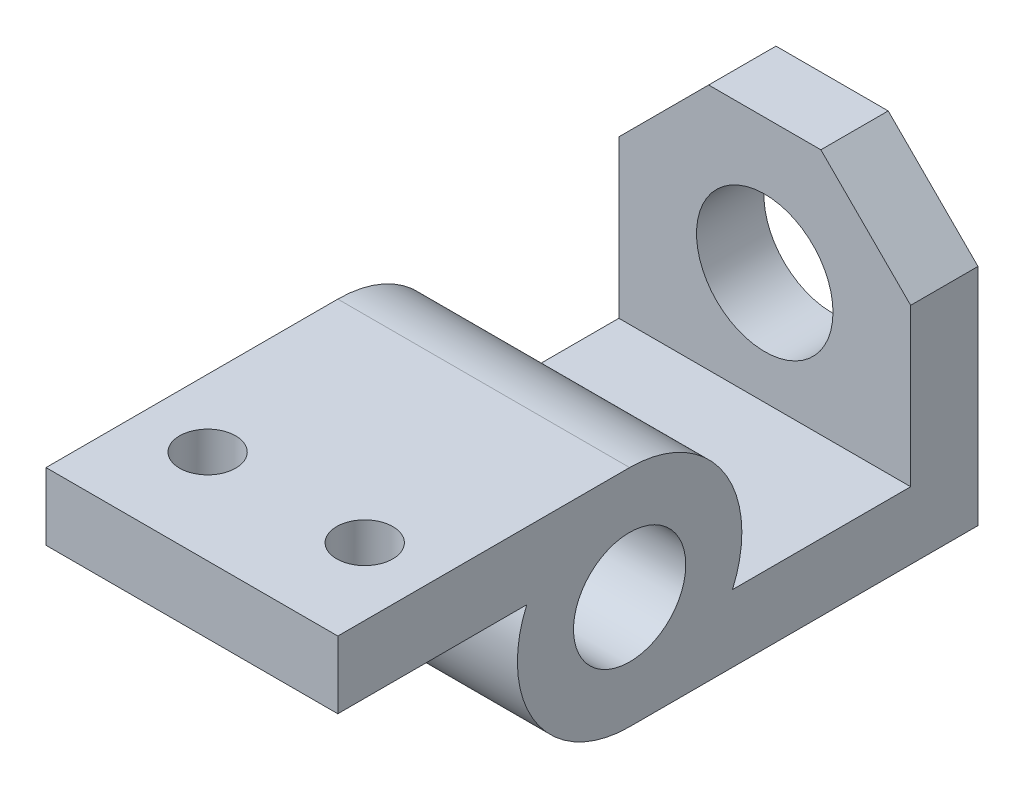
from build123d import *

# Parameters (mm, degrees)
SKETCH2_R           = 15.875
BOSS_EXTRUDE1_DEPTH = 82.55
SKETCH4_R           = 7.9375
CUT_EXTRUDE1_DEPTH  = 144.384968543
SKETCH5_R           = 19.304
CUT_EXTRUDE2_DEPTH  = 191.634403254


with BuildPart() as part:
    # Sketch2 → Boss-Extrude1 (new body)
    with BuildSketch(Plane(origin=(0, 0, 0), x_dir=(0, 0, -1), z_dir=(1, 0, 0))):
        with BuildLine():
            ThreePointArc((29.099355663, -12.7), (26.563955842, 17.390191201), (0, 31.75))
            Line((0, 31.75), (-82.55, 31.75))
            Line((-82.55, 31.75), (-82.55, 12.7))
            Line((-82.55, 12.7), (-29.099355663, 12.7))
            ThreePointArc((-29.099355663, 12.7), (-26.563955842, -17.390191201), (0, -31.75))
            Line((0, -31.75), (98.552, -31.75))
            Line((98.552, -31.75), (98.552, 57.15))
            Line((98.552, 57.15), (79.502, 57.15))
            Line((79.502, 57.15), (79.502, -12.7))
            Line((79.502, -12.7), (29.099355663, -12.7))
        make_face()
        Circle(SKETCH2_R, mode=Mode.SUBTRACT)
    extrude(amount=-BOSS_EXTRUDE1_DEPTH)

    # Sketch4 → Cut-Extrude1 (cut, through all)
    with BuildSketch(Plane(origin=(0, 31.75, 0), x_dir=(1, 0, 0), z_dir=(0, 1, 0))):
        with Locations((-63.5, -55.88)):
            Circle(SKETCH4_R)
        with Locations((-19.05, -55.88)):
            Circle(SKETCH4_R)
    extrude(amount=-CUT_EXTRUDE1_DEPTH, mode=Mode.SUBTRACT)

    # Sketch5 → Cut-Extrude2 (cut, through all)
    with BuildSketch(Plane.XY.offset(-79.502)):
        Polygon((-25.4, 57.15), (0, 31.75), (0, 57.15), align=None)
        Polygon((-82.55, 31.75), (-57.15, 57.15), (-82.55, 57.15), align=None)
        with Locations((-41.275, 19.05)):
            Circle(SKETCH5_R)
    extrude(amount=-CUT_EXTRUDE2_DEPTH, mode=Mode.SUBTRACT)


solid = part.part
